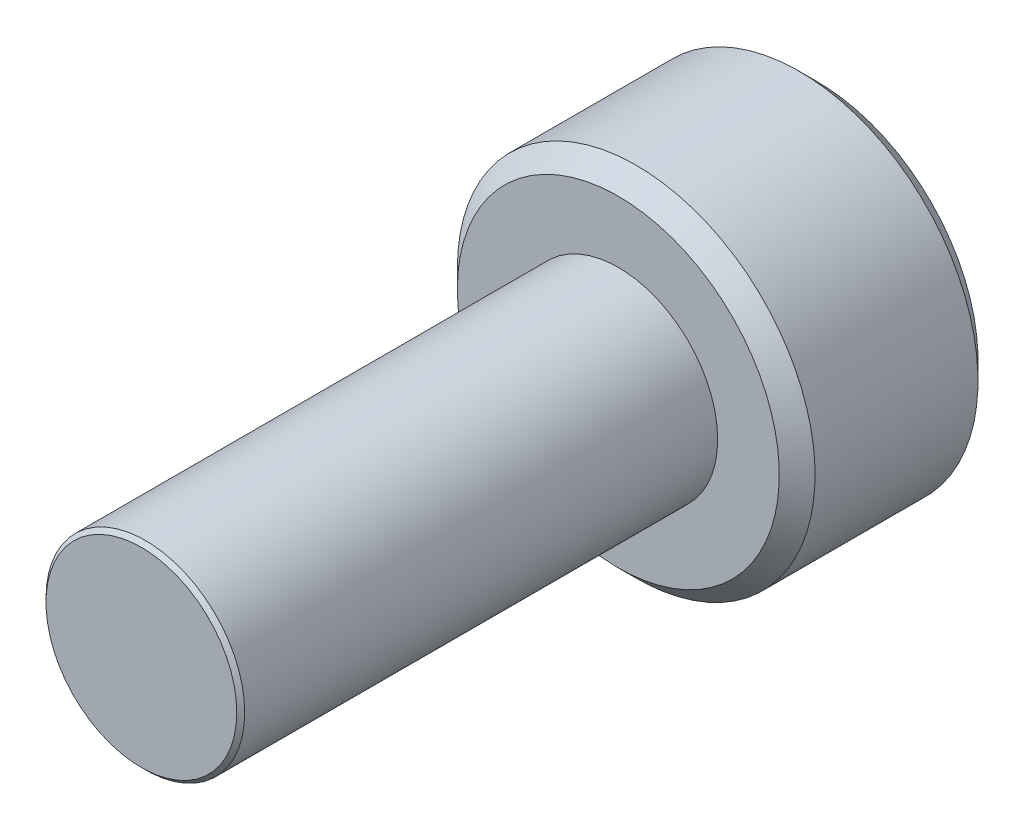
from build123d import *

# Parameters (mm, degrees)
SKETCH1_R            = 1.25
EXTRUDE1_DEPTH       = 6
CUT_SWEEP1_PITCH     = 0.45
SKETCH6_R            = 2.25
EXTRUDE2_DEPTH       = 2.5
CUT_EXTRUDE1_DEPTH   = 1.5
CHAMFER1_SIZE        = 0.225
SKETCH10_R           = 1.25
PARTIAL_THREAD_DEPTH = 6
CHAMFER2_SIZE        = 0.05


with BuildPart() as part:
    # Sketch1 → Extrude1 (new body)
    with BuildSketch(Plane.XY):
        Circle(SKETCH1_R)
    extrude(amount=-EXTRUDE1_DEPTH)

    # Cut-Sweep1: arcs per turn and ends read off the stored shape
    # Cut-Sweep1: the profile of Sketch3 profile screwed along a right-hand helix through 16 turns, 6 arcs to a turn; built about Z, then put on its axis
    cut_sweep1_z = Axis((0, 0, 0), (0, 0, 1))
    cut_sweep1_corners = [(1.2503, 0, -0.843923205), (0.957716426, 0, -0.675), (0.957716426, 0, -0.61875), (1.2503, 0, -0.449826795)]
    with BuildLine(mode=Mode.PRIVATE) as cut_sweep1_profile:
        Line(cut_sweep1_corners[0], cut_sweep1_corners[1])
        Line(cut_sweep1_corners[1], cut_sweep1_corners[2])
        Line(cut_sweep1_corners[2], cut_sweep1_corners[3])
        Line(cut_sweep1_corners[3], cut_sweep1_corners[0])
    cut_sweep1_cap = Face(cut_sweep1_profile.wire())
    cut_sweep1_turn_angles = [0, 30, 60, 90, 120, 150, 180, 210, 240, 270, 300, 330, 360]
    cut_sweep1_turn_weights = [1, 0.8660254037844387, 1, 0.8660254037844387, 1, 0.8660254037844387, 1, 0.8660254037844387, 1, 0.8660254037844387, 1, 0.8660254037844387, 1]
    cut_sweep1_turn_rails = [Edge.make_bspline([Vector(p[0], p[1], 0).rotate(cut_sweep1_z, cut_sweep1_turn_angles[k]) / cut_sweep1_turn_weights[k] + Vector(0, 0, p[2] + CUT_SWEEP1_PITCH * cut_sweep1_turn_angles[k] / 360) for k in range(13)], [0, 0, 0, 1, 1, 2, 2, 3, 3, 4, 4, 5, 5, 6, 6, 6], 2, cut_sweep1_turn_weights) for p in cut_sweep1_corners]
    cut_sweep1_turn_sides = [Face.make_surface_from_curves(cut_sweep1_turn_rails[p[0]], cut_sweep1_turn_rails[p[1]]) for p in [(0, 1), (1, 2), (2, 3), (3, 0)]]
    cut_sweep1 = Plane(origin=(0, 0, 0), x_dir=(0, 1, 0), z_dir=(0, 0, -1)) * Solid(Shell([*[p.moved(Location((0, 0, CUT_SWEEP1_PITCH * i))) for i in range(16) for p in cut_sweep1_turn_sides], cut_sweep1_cap, cut_sweep1_cap.rotate(cut_sweep1_z, 5760).moved(Location((0, 0, CUT_SWEEP1_PITCH * 5760 / 360)))]))
    add(cut_sweep1, mode=Mode.SUBTRACT)

    # Sketch4 → Cut-Revolve1 (revolve, cut)
    with BuildSketch(Plane(origin=(0, 0, 0), x_dir=(0, 0, -1), z_dir=(1, 0, 0)), mode=Mode.PRIVATE) as cut_revolve1_sk:
        Polygon((0.382511876, 1.25), (0, 0.703716426), (0, 1.25), align=None)
    revolve(cut_revolve1_sk.sketch.rotate(Axis((0, 0, 0), (0, 0, -1)), 270), axis=Axis((0, 0, 0), (0, 0, -1)), mode=Mode.SUBTRACT)

    # Sketch6 → Extrude2 (add)
    with BuildSketch(Plane(origin=(0, 0, -6), x_dir=(-1, 0, 0), z_dir=(0, 0, -1))):
        Circle(SKETCH6_R)
    extrude(amount=EXTRUDE2_DEPTH)

    # Sketch7 → Cut-Extrude1 (cut)
    with BuildSketch(Plane(origin=(0, 0, -8.5), x_dir=(-1, 0, 0), z_dir=(0, 0, -1))):
        Polygon((0, 1.154700538), (-1, 0.577350269), (-1, -0.577350269), (0, -1.154700538), (1, -0.577350269), (1, 0.577350269), align=None)
    extrude(amount=-CUT_EXTRUDE1_DEPTH, mode=Mode.SUBTRACT)

    # Cut-Extrude2 cone 1 section (through the dimple's axis) → Cut-Extrude2 (revolve, cut)
    with BuildSketch(Plane(origin=(0, 0, -8.5), x_dir=(0, 1, 0), z_dir=(1, 0, 0))):
        Polygon((0, 0), (1.154700538, 0), (0, 1.154700538), align=None)
    revolve(axis=Axis((0, 0, -8.5), (0, 0, 1)), mode=Mode.SUBTRACT)

    # Chamfer1
    chamfer1_edges = [part.edges().sort_by_distance(p)[0] for p in [
        (2.25, 0, -6),
        (2.25, 0, -8.5),
    ]]
    chamfer(chamfer1_edges, length=CHAMFER1_SIZE)


with BuildPart() as body_2:
    # Sketch10 → partial thread (new body)
    with BuildSketch(Plane.XY.offset(-6)):
        Circle(SKETCH10_R)
    extrude(amount=PARTIAL_THREAD_DEPTH)

    # Chamfer2
    chamfer2_edges = [body_2.edges().sort_by_distance(p)[0] for p in [
        (-1.25, 0, 0),
    ]]
    chamfer(chamfer2_edges, length=CHAMFER2_SIZE)


with BuildPart() as part_1:
    add(part.part)

    # Combine1: union body 2
    add(body_2.part)


solid = part_1.part
